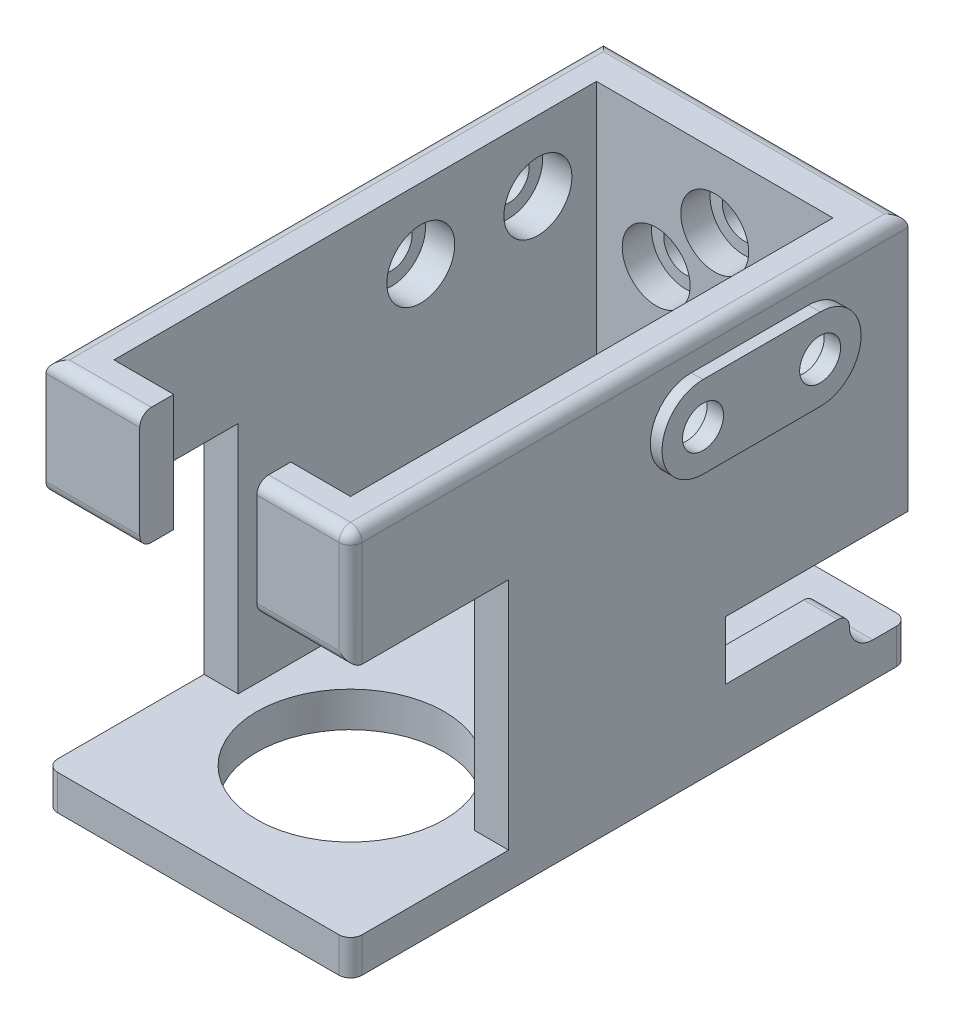
from build123d import *

# Parameters (mm, degrees)
BOSS_EXTRUDE1_DEPTH      = 10
SKETCH2_W                = 20
SKETCH2_H                = 17
BOSS_EXTRUDE2_DEPTH      = 3
SKETCH3_W                = 26
SKETCH3_H                = 47
BOSS_EXTRUDE3_DEPTH      = 3
SKETCH5_R                = 8
SKETCH5_W                = 16
SKETCH5_H                = 4
CUT_EXTRUDE1_DEPTH       = 41.264748851
BOSS_EXTRUDE4_DEPTH      = 26
SKETCH7_W                = 20
SKETCH7_H                = 10.5
CUT_EXTRUDE2_DEPTH       = 10
SKETCH9_W                = 8
SKETCH9_H                = 6
CUT_EXTRUDE3_DEPTH       = 10
SKETCH10_W               = 30
SKETCH10_H               = 30
BOSS_EXTRUDE5_DEPTH      = 3
SKETCH11_R               = 1.75
CUT_EXTRUDE4_DEPTH       = 5
BOSS_EXTRUDE6_START      = 3
SKETCH12_W               = 26
SKETCH12_H               = 47
SKETCH12_R               = 8
BOSS_EXTRUDE6_DEPTH      = 3
CUT_EXTRUDE5_START       = -3
SKETCH14_R               = 8
SKETCH14_W               = 16
SKETCH14_H               = 4
CUT_EXTRUDE5_DEPTH       = 3
CUT_EXTRUDE7_DEPTH       = 49.674942219
CUT_EXTRUDE7_DEPTH_BACK  = 49.674942219
BOSS_EXTRUDE7_DEPTH      = 10.7
SKETCH18_W               = 15
SKETCH18_H               = 5
CUT_EXTRUDE8_DEPTH       = 10
SKETCH21_R               = 1.85
CUT_EXTRUDE9_DEPTH       = 5
SKETCH22_R               = 2.9
CUT_EXTRUDE10_DEPTH      = 2.6
BOSS_EXTRUDE11_OUTLINE_R = 1.85
BOSS_EXTRUDE11_DEPTH     = 0.6
SKETCH24_R               = 1.85
BOSS_EXTRUDE12_DEPTH     = 4
SKETCH25_W               = 7
SKETCH25_H               = 3
CUT_EXTRUDE11_DEPTH      = 5
SKETCH26_W               = 20.2
SKETCH26_H               = 41.2
CUT_EXTRUDE12_DEPTH      = 30
SKETCH27_W               = 0.1
SKETCH27_H               = 3
CUT_EXTRUDE13_DEPTH      = 55.440426156
SKETCH28_R               = 8
CUT_EXTRUDE14_DEPTH      = 46.250524859
SKETCH29_W               = 2.9
SKETCH29_H               = 3
CUT_EXTRUDE15_DEPTH      = 5
FILLET1_R                = 2
FILLET2_R                = 2
FILLET3_R                = 1
SKETCH30_W               = 4.827498142
SKETCH30_H               = 18.818593056
CUT_EXTRUDE16_DEPTH      = 45.661056862
SKETCH31_R               = 1.75
CUT_EXTRUDE17_DEPTH      = 43.258845228
SKETCH32_R               = 2.9
CUT_EXTRUDE18_DEPTH      = 2.5
SKETCH33_R               = 1.75
BOSS_EXTRUDE13_DEPTH     = 1
BOSS_EXTRUDE14_START     = -1
SKETCH34_R               = 8
SKETCH34_R_2             = 4
BOSS_EXTRUDE14_DEPTH     = 1
BOSS_EXTRUDE15_START     = 2
BOSS_EXTRUDE15_DEPTH     = 2


# Read off the part's stored shape, not the designer's step: Boss-Extrude11
with BuildPart() as part:
    # Sketch1 → Boss-Extrude1 (new body)
    with BuildSketch(Plane(origin=(0, 0, 0), x_dir=(1, 0, 0), z_dir=(0, 1, 0))):
        Polygon((5, -23.5), (13, -23.5), (13, 23.5), (-13, 23.5), (-13, -23.5), (-5, -23.5), (-5, -20.5), (-10, -20.5), (-10, 20.5), (10, 20.5), (10, -20.5), (5, -20.5), align=None)
    extrude(amount=BOSS_EXTRUDE1_DEPTH)

    # Sketch2 → Boss-Extrude2 (add)
    with BuildSketch(Plane(origin=(13, 0, 0), x_dir=(0, 0, -1), z_dir=(1, 0, 0))):
        with Locations((0, -8.5)):
            Rectangle(SKETCH2_W, SKETCH2_H)
    boss_extrude2 = extrude(amount=-BOSS_EXTRUDE2_DEPTH)

    # Mirror1: Boss-Extrude2 across plane
    add(boss_extrude2.mirror(Plane(origin=(0, 0, 0), x_dir=(0, 0, 1), z_dir=(1, 0, 0))))

    # Sketch3 → Boss-Extrude3 (add)
    with BuildSketch(Plane.XZ.offset(17)):
        Rectangle(SKETCH3_W, SKETCH3_H)
    extrude(amount=BOSS_EXTRUDE3_DEPTH)

    # Sketch5 → Cut-Extrude1 (cut, through all)
    with BuildSketch(Plane.XZ.offset(20)):
        with Locations(Location((0, 10.5, 0), (0, 0, 270))):
            Circle(SKETCH5_R)
        with Locations((0, -6.5)):
            Rectangle(SKETCH5_W, SKETCH5_H)
        with Locations((0, -14.5)):
            Rectangle(SKETCH5_W, SKETCH5_H)
    extrude(amount=-CUT_EXTRUDE1_DEPTH, mode=Mode.SUBTRACT)

    # Sketch6 → Boss-Extrude4 (add)
    with BuildSketch(Plane(origin=(13, 0, 0), x_dir=(0, 0, -1), z_dir=(1, 0, 0))):
        Polygon((29.5, 4.35), (23.5, 4.35), (23.5, 0), (23.5, -3.65), (29.5, -3.65), align=None)
        Polygon((23.5, -3.65), (23.5, 0), (10, 0), (10, -9.3), (23.5, -9.3), align=None)
    extrude(amount=-BOSS_EXTRUDE4_DEPTH)

    # Sketch7 → Cut-Extrude2 (cut)
    with BuildSketch(Plane(origin=(0, 0, 0), x_dir=(1, 0, 0), z_dir=(0, 1, 0))):
        with Locations((0, 15.25)):
            Rectangle(SKETCH7_W, SKETCH7_H)
    extrude(amount=-CUT_EXTRUDE2_DEPTH, mode=Mode.SUBTRACT)

    # Sketch9 → Cut-Extrude3 (cut)
    with BuildSketch(Plane(origin=(0, 4.35, 0), x_dir=(1, 0, 0), z_dir=(0, 1, 0))):
        with Locations((-9, 26.5)):
            Rectangle(SKETCH9_W, SKETCH9_H)
        with Locations((9, 26.5)):
            Rectangle(SKETCH9_W, SKETCH9_H)
    extrude(amount=-CUT_EXTRUDE3_DEPTH, mode=Mode.SUBTRACT)

    # Sketch10 → Boss-Extrude5 (add)
    with BuildSketch(Plane(origin=(0, 0, -29.5), x_dir=(-1, 0, 0), z_dir=(0, 0, -1))):
        Rectangle(SKETCH10_W, SKETCH10_H)
    extrude(amount=BOSS_EXTRUDE5_DEPTH)

    # Sketch11 → Cut-Extrude4 (cut)
    with BuildSketch(Plane(origin=(0, 0, -32.5), x_dir=(-1, 0, 0), z_dir=(0, 0, -1))):
        with Locations((0, 10)):
            Circle(SKETCH11_R)
        with Locations((10, 0)):
            Circle(SKETCH11_R)
        with Locations((0, -10)):
            Circle(SKETCH11_R)
        with Locations((-10, 0)):
            Circle(SKETCH11_R)
    extrude(amount=-CUT_EXTRUDE4_DEPTH, mode=Mode.SUBTRACT)

    # Sketch12 → Boss-Extrude6 (add)
    with BuildSketch(Plane.XZ.offset(20).offset(BOSS_EXTRUDE6_START)):
        Rectangle(SKETCH12_W, SKETCH12_H)
        with Locations(Location((0, 10.5, 0), (0, 0, 270))):
            Circle(SKETCH12_R, mode=Mode.SUBTRACT)
    extrude(amount=-BOSS_EXTRUDE6_DEPTH)

    # Sketch14 → Cut-Extrude5 (cut)
    with BuildSketch(Plane(origin=(0, -17, 0), x_dir=(1, 0, 0), z_dir=(0, 1, 0)).offset(CUT_EXTRUDE5_START)):
        Polygon((13, -23.5), (13, -10), (10, -10), (10, 10), (13, 10), (13, 23.5), (-13, 23.5), (-13, 10), (-10, 10), (-10, -10), (-13, -10), (-13, -23.5), align=None)
        with Locations(Location((0, -10.5, 0), (0, 0, 90))):
            Circle(SKETCH14_R, mode=Mode.SUBTRACT)
        with Locations((0, 6.5)):
            Rectangle(SKETCH14_W, SKETCH14_H, mode=Mode.SUBTRACT)
        with Locations((0, 14.5)):
            Rectangle(SKETCH14_W, SKETCH14_H, mode=Mode.SUBTRACT)
    extrude(amount=CUT_EXTRUDE5_DEPTH, mode=Mode.SUBTRACT)

    # Sketch15 → Cut-Extrude7 (cut, two sides: drawn at the far end of the back side and taken through both)
    with BuildSketch(Plane(origin=(13, 0, 0), x_dir=(0, 0, -1), z_dir=(1, 0, 0)).offset(-CUT_EXTRUDE7_DEPTH_BACK)):
        Polygon((23.5, -9.3), (23.5, -15.243835525), (32.5, -15.243835525), (32.5, 15), (23.5, 15), (23.5, 10), align=None)
    extrude(amount=CUT_EXTRUDE7_DEPTH + CUT_EXTRUDE7_DEPTH_BACK, mode=Mode.SUBTRACT)

    # Sketch16 → Boss-Extrude7 (add)
    with BuildSketch(Plane.XZ.offset(9.3)):
        Polygon((10, -10), (10, -20.5), (-10, -20.5), (-10, -10), (-13, -10), (-13, -23.5), (13, -23.5), (13, -10), align=None)
    extrude(amount=BOSS_EXTRUDE7_DEPTH)

    # Sketch18 → Cut-Extrude8 (cut)
    with BuildSketch(Plane(origin=(13, 0, 0), x_dir=(0, 0, -1), z_dir=(1, 0, 0))):
        with Locations((16, -14.5)):
            Rectangle(SKETCH18_W, SKETCH18_H)
    cut_extrude8 = extrude(amount=-CUT_EXTRUDE8_DEPTH, mode=Mode.SUBTRACT)

    # Mirror2: Cut-Extrude8 across plane
    add(cut_extrude8.mirror(Plane(origin=(0, 0, 0), x_dir=(0, 0, 1), z_dir=(1, 0, 0))), mode=Mode.SUBTRACT)

    # Sketch21 → Cut-Extrude9 (cut)
    with BuildSketch(Plane(origin=(0, 0, -23.5), x_dir=(-1, 0, 0), z_dir=(0, 0, -1))):
        with Locations((-5, -1.15)):
            Circle(SKETCH21_R)
        with Locations((0, 3.85)):
            Circle(SKETCH21_R)
        with Locations((5, -1.15)):
            Circle(SKETCH21_R)
        with Locations((0, -6.15)):
            Circle(SKETCH21_R)
    extrude(amount=-CUT_EXTRUDE9_DEPTH, mode=Mode.SUBTRACT)

    # Sketch22 → Cut-Extrude10 (cut)
    with BuildSketch(Plane.XY.offset(-20.5)):
        with Locations((0, 3.85)):
            Circle(SKETCH22_R)
        with Locations((5, -1.15)):
            Circle(SKETCH22_R)
        with Locations((0, -6.15)):
            Circle(SKETCH22_R)
        with Locations((-5, -1.15)):
            Circle(SKETCH22_R)
    extrude(amount=-CUT_EXTRUDE10_DEPTH, mode=Mode.SUBTRACT)

    # Boss-Extrude11 outline → Boss-Extrude11 (add)
    with BuildSketch(Plane(origin=(0, 0, -23.5), x_dir=(-1, 0, 0), z_dir=(0, 0, -1))):
        Polygon((-13, -12), (-3, -12), (-3, -17), (-13, -17), (-13, -23), (13, -23), (13, -17), (3, -17), (3, -12), (13, -12), (13, 10), (-13, 10), align=None)
        with Locations((-5, -1.15)):
            Circle(BOSS_EXTRUDE11_OUTLINE_R, mode=Mode.SUBTRACT)
        with Locations((0, -6.15)):
            Circle(BOSS_EXTRUDE11_OUTLINE_R, mode=Mode.SUBTRACT)
        with Locations((5, -1.15)):
            Circle(BOSS_EXTRUDE11_OUTLINE_R, mode=Mode.SUBTRACT)
        with Locations((0, 3.85)):
            Circle(BOSS_EXTRUDE11_OUTLINE_R, mode=Mode.SUBTRACT)
    extrude(amount=BOSS_EXTRUDE11_DEPTH)

    # Sketch24 → Boss-Extrude12 (add)
    with BuildSketch(Plane(origin=(0, 0, -24.1), x_dir=(-1, 0, 0), z_dir=(0, 0, -1))):
        with BuildLine():
            ThreePointArc((-7.5, 3.35), (-6.621320344, 5.471320344), (-4.5, 6.35))
            Line((-4.5, 6.35), (4.5, 6.35))
            ThreePointArc((4.5, 6.35), (6.621320344, 5.471320344), (7.5, 3.35))
            Line((7.5, 3.35), (7.5, -5.65))
            ThreePointArc((7.5, -5.65), (6.621320344, -7.771320344), (4.5, -8.65))
            Line((4.5, -8.65), (-4.5, -8.65))
            ThreePointArc((-4.5, -8.65), (-6.621320344, -7.771320344), (-7.5, -5.65))
            Line((-7.5, -5.65), (-7.5, 3.35))
        make_face()
        with Locations((0, -6.15)):
            Circle(SKETCH24_R, mode=Mode.SUBTRACT)
        with Locations((5, -1.15)):
            Circle(SKETCH24_R, mode=Mode.SUBTRACT)
        with Locations((-5, -1.15)):
            Circle(SKETCH24_R, mode=Mode.SUBTRACT)
        with Locations((0, 3.85)):
            Circle(SKETCH24_R, mode=Mode.SUBTRACT)
    extrude(amount=BOSS_EXTRUDE12_DEPTH)

    # Sketch25 → Cut-Extrude11 (cut)
    with BuildSketch(Plane(origin=(0, 0, -24.1), x_dir=(-1, 0, 0), z_dir=(0, 0, -1))):
        with Locations((-6.5, -18.5)):
            Rectangle(SKETCH25_W, SKETCH25_H)
        with Locations((6.5, -18.5)):
            Rectangle(SKETCH25_W, SKETCH25_H)
    extrude(amount=-CUT_EXTRUDE11_DEPTH, mode=Mode.SUBTRACT)

    # Sketch26 → Cut-Extrude12 (cut)
    with BuildSketch(Plane(origin=(0, 10, 0), x_dir=(1, 0, 0), z_dir=(0, 1, 0))):
        Rectangle(SKETCH26_W, SKETCH26_H)
    extrude(amount=-CUT_EXTRUDE12_DEPTH, mode=Mode.SUBTRACT)

    # Sketch27 → Cut-Extrude13 (cut, through all)
    with BuildSketch(Plane(origin=(0, 0, -24.1), x_dir=(-1, 0, 0), z_dir=(0, 0, -1))):
        with Locations((-10.05, -18.5)):
            Rectangle(SKETCH27_W, SKETCH27_H)
        with Locations((10.05, -18.5)):
            Rectangle(SKETCH27_W, SKETCH27_H)
    extrude(amount=-CUT_EXTRUDE13_DEPTH, mode=Mode.SUBTRACT)

    # Sketch28 → Cut-Extrude14 (cut, through all)
    with BuildSketch(Plane.XZ.offset(23)):
        with Locations(Location((0, -11.1, 0), (0, 0, 270))):
            Circle(SKETCH28_R)
    extrude(amount=-CUT_EXTRUDE14_DEPTH, mode=Mode.SUBTRACT)

    # Sketch29 → Cut-Extrude15 (cut)
    with BuildSketch(Plane(origin=(0, 0, -24.1), x_dir=(-1, 0, 0), z_dir=(0, 0, -1))):
        with Locations((-11.55, -18.5)):
            Rectangle(SKETCH29_W, SKETCH29_H)
        with Locations((11.55, -18.5)):
            Rectangle(SKETCH29_W, SKETCH29_H)
    extrude(amount=-CUT_EXTRUDE15_DEPTH, mode=Mode.SUBTRACT)

    # Fillet1
    fillet1_edges = [part.edges().sort_by_distance(p)[0] for p in [
        (-3, -20, -22.35),
        (3, -20, -22.35),
    ]]
    fillet(fillet1_edges, radius=FILLET1_R)

    # Fillet2
    fillet2_edges = [part.edges().sort_by_distance(p)[0] for p in [
        (11.55, -20, -19.1),
        (-11.55, -20, -19.1),
    ]]
    fillet(fillet2_edges, radius=FILLET2_R)

    # Fillet3
    fillet3_edges = [part.edges().sort_by_distance(p)[0] for p in [
        (11.55, -17, -19.1),
        (-11.55, -17, -19.1),
        (-9, 10, 23.5),
        (-13, 10, -0.3),
        (0, 10, -24.1),
        (13, 10, -0.3),
        (9, 10, 23.5),
        (13, 5, 23.5),
        (9, 0, 23.5),
        (-9, 0, 23.5),
        (13, -21.5, -24.1),
        (-13, -21.5, -24.1),
        (-13, -21.5, 23.5),
        (13, -21.5, 23.5),
    ]]
    fillet(fillet3_edges, radius=FILLET3_R - 0.0001)  # a hair under: the kernel refuses the full size

    # Sketch30 → Cut-Extrude16 (cut, through all)
    with BuildSketch(Plane.ZY.offset(13)):
        with Locations((-26.513749071, -1.642619156)):
            Rectangle(SKETCH30_W, SKETCH30_H)
    extrude(amount=-CUT_EXTRUDE16_DEPTH, mode=Mode.SUBTRACT)

    # Sketch31 → Cut-Extrude17 (cut, through all)
    with BuildSketch(Plane.ZY.offset(13)):
        with Locations((-15.6, 4)):
            Circle(SKETCH31_R)
        with Locations((-5.6, 4)):
            Circle(SKETCH31_R)
    extrude(amount=-CUT_EXTRUDE17_DEPTH, mode=Mode.SUBTRACT)

    # Sketch32 → Cut-Extrude18 (cut)
    with BuildSketch(Plane.ZY.offset(-10.1)):
        with Locations((-15.6, 4)):
            Circle(SKETCH32_R)
        with Locations((-5.6, 4)):
            Circle(SKETCH32_R)
    cut_extrude18 = extrude(amount=-CUT_EXTRUDE18_DEPTH, mode=Mode.SUBTRACT)

    # Sketch33 → Boss-Extrude13 (add)
    with BuildSketch(Plane(origin=(13, 0, 0), x_dir=(0, 0, -1), z_dir=(1, 0, 0))):
        with BuildLine():
            Line((5.6, 7.5), (15.6, 7.5))
            ThreePointArc((15.6, 7.5), (19.1, 4), (15.6, 0.5))
            Line((15.6, 0.5), (5.6, 0.5))
            ThreePointArc((5.6, 0.5), (2.1, 4), (5.6, 7.5))
        make_face()
        with Locations(Location((5.6, 4, 0), (0, 0, 180))):
            Circle(SKETCH33_R, mode=Mode.SUBTRACT)
        with Locations(Location((15.6, 4, 0), (0, 0, 180))):
            Circle(SKETCH33_R, mode=Mode.SUBTRACT)
    boss_extrude13 = extrude(amount=BOSS_EXTRUDE13_DEPTH)

    # Mirror3: Boss-Extrude13 across plane
    add(boss_extrude13.mirror(Plane(origin=(0, 0, 0), x_dir=(0, 0, 1), z_dir=(1, 0, 0))))

    # Mirror4: Cut-Extrude18 across plane
    add(cut_extrude18.mirror(Plane(origin=(0, 0, 0), x_dir=(0, 0, 1), z_dir=(1, 0, 0))), mode=Mode.SUBTRACT)

    # Sketch34 → Boss-Extrude14 (add)
    with BuildSketch(Plane(origin=(0, -20, 0), x_dir=(1, 0, 0), z_dir=(0, 1, 0)).offset(BOSS_EXTRUDE14_START)):
        with Locations(Location((0, 11.1, 0), (0, 0, 90))):
            Circle(SKETCH34_R)
        with Locations(Location((0, 11.1, 0), (0, 0, 270))):
            Circle(SKETCH34_R_2, mode=Mode.SUBTRACT)
    extrude(amount=BOSS_EXTRUDE14_DEPTH)

    # Sketch35 → Boss-Extrude15 (add)
    with BuildSketch(Plane.XZ.offset(23).offset(BOSS_EXTRUDE15_START)):
        with BuildLine():
            ThreePointArc((6.5, -15.763689527), (5.157547679, -17.215529571), (3.5, -18.293747285))
            Line((3.5, -18.293747285), (3.5, -24.1))
            Line((3.5, -24.1), (6.5, -24.1))
            Line((6.5, -24.1), (6.5, -15.763689527))
        make_face()
        with BuildLine():
            Line((-3.5, -24.1), (-3.5, -18.293747285))
            ThreePointArc((-3.5, -18.293747285), (-5.157547679, -17.215529571), (-6.5, -15.763689527))
            Line((-6.5, -15.763689527), (-6.5, -24.1))
            Line((-6.5, -24.1), (-3.5, -24.1))
        make_face()
    extrude(amount=-BOSS_EXTRUDE15_DEPTH)


solid = part.part
